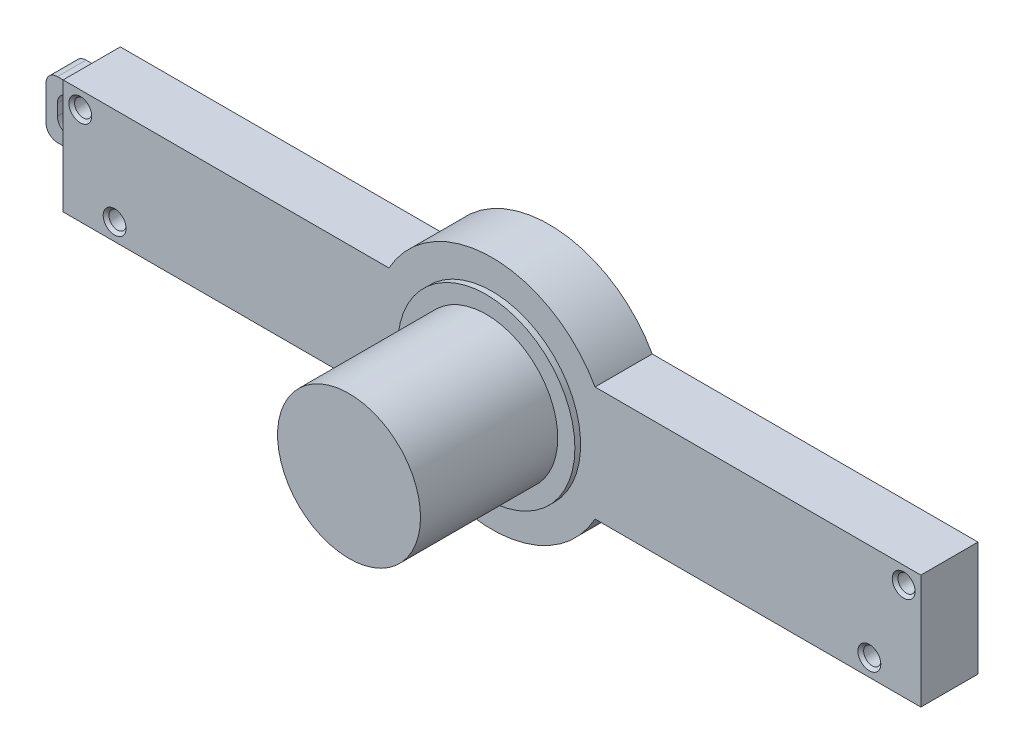
from build123d import *

# Parameters (mm, degrees)
SZKIC1_W                    = 150
SZKIC1_H                    = 20
DODANIE_WYCI_GNI_CIE1_DEPTH = 10
SZKIC2_R                    = 20.61119484
DODANIE_WYCI_GNI_CIE2_DEPTH = 10
SZKIC3_R                    = 12.5
DODANIE_WYCI_GNI_CIE5_DEPTH = 25
SZKIC8_R                    = 15.5
DODANIE_WYCI_GNI_CIE6_DEPTH = 1
SZKIC9_R                    = 1.5
WYTNIJ_WYCI_GNI_CIE1_DEPTH  = 10
SFAZOWANIE1_SIZE            = 0.5
SZKIC10_W                   = 5
SZKIC10_H                   = 10
DODANIE_WYCI_GNI_CIE7_DEPTH = 8
SZKIC11_W                   = 6
SZKIC11_H                   = 6
WYTNIJ_WYCI_GNI_CIE2_DEPTH  = 8
ZAOKR_GLENIE1_R             = 2


with BuildPart() as part:
    # Szkic1 → Dodanie-wyciągnięcie1 (new body)
    with BuildSketch(Plane.XY):
        Rectangle(SZKIC1_W, SZKIC1_H)
    extrude(amount=DODANIE_WYCI_GNI_CIE1_DEPTH)

    # Szkic2 → Dodanie-wyciągnięcie2 (add)
    with BuildSketch(Plane.XY.offset(10)):
        Circle(SZKIC2_R)
    extrude(amount=-DODANIE_WYCI_GNI_CIE2_DEPTH)

    # Szkic3 → Dodanie-wyciągnięcie5 (add)
    with BuildSketch(Plane.XY.offset(10)):
        Circle(SZKIC3_R)
    extrude(amount=DODANIE_WYCI_GNI_CIE5_DEPTH)

    # Szkic8 → Dodanie-wyciągnięcie6 (add)
    with BuildSketch(Plane.XY.offset(10)):
        Circle(SZKIC8_R)
    extrude(amount=DODANIE_WYCI_GNI_CIE6_DEPTH)

    # Szkic9 → Wytnij-wyciągnięcie1 (cut)
    with BuildSketch(Plane(origin=(0, 0, 0), x_dir=(-1, 0, 0), z_dir=(0, 0, -1))):
        with Locations((-72, 7)):
            Circle(SZKIC9_R)
        with Locations((-66, -7)):
            Circle(SZKIC9_R)
        with Locations((66, -7)):
            Circle(SZKIC9_R)
        with Locations((72, 7)):
            Circle(SZKIC9_R)
    extrude(amount=-WYTNIJ_WYCI_GNI_CIE1_DEPTH, mode=Mode.SUBTRACT)

    # Sfazowanie1
    sfazowanie1_edges = [part.edges().sort_by_distance(p)[0] for p in [
        (-64.5, -7, 10),
        (-70.5, 7, 10),
        (67.5, -7, 10),
        (73.5, 7, 10),
    ]]
    chamfer(sfazowanie1_edges, length=SFAZOWANIE1_SIZE)

    # Szkic10 → Dodanie-wyciągnięcie7 (add)
    with BuildSketch(Plane.ZY.offset(75)):
        with Locations((2.5, 0)):
            Rectangle(SZKIC10_W, SZKIC10_H)
    extrude(amount=DODANIE_WYCI_GNI_CIE7_DEPTH)

    # Szkic11 → Wytnij-wyciągnięcie2 (cut)
    with BuildSketch(Plane(origin=(0, 0, 0), x_dir=(-1, 0, 0), z_dir=(0, 0, -1))):
        with Locations((78, 0)):
            Rectangle(SZKIC11_W, SZKIC11_H)
    extrude(amount=-WYTNIJ_WYCI_GNI_CIE2_DEPTH, mode=Mode.SUBTRACT)

    # Zaokrąglenie1
    zaokr_glenie1_edges = [part.edges().sort_by_distance(p)[0] for p in [
        (-83, -5, 2.5),
        (-83, 5, 2.5),
        (-81, -3, 2.5),
        (-81, 3, 2.5),
    ]]
    fillet(zaokr_glenie1_edges, radius=ZAOKR_GLENIE1_R)


solid = part.part
